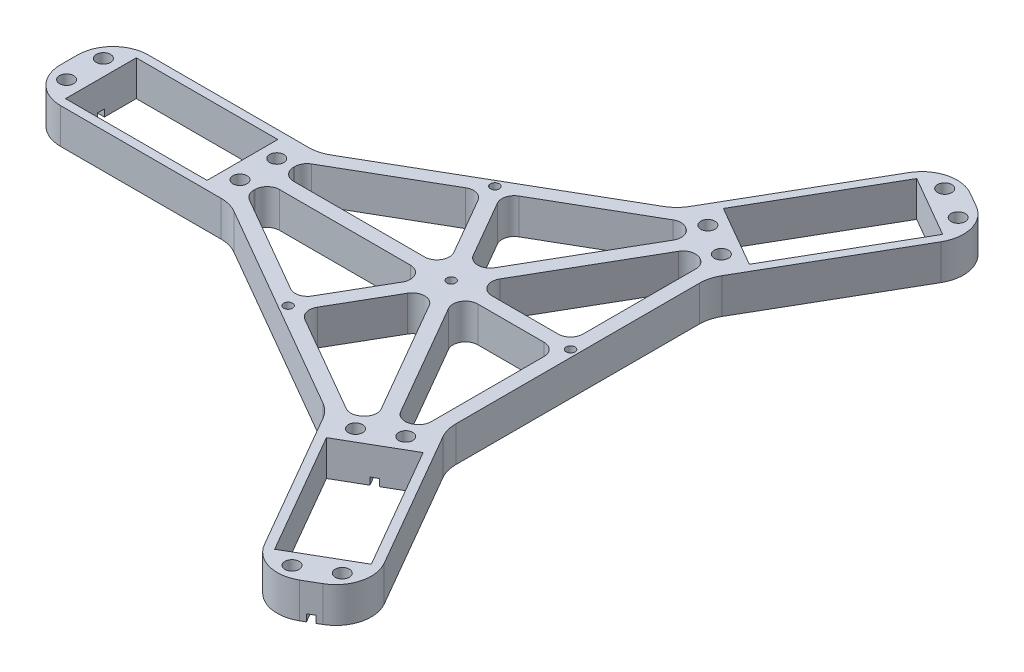
from build123d import *

# Parameters (mm, degrees)
SKETCH1_R           = 2
SKETCH1_W           = 40
SKETCH1_H           = 20
SKETCH1_R_2         = 1.25
BOSS_EXTRUDE1_DEPTH = 10
SKETCH2_W           = 2
SKETCH2_H           = 4
CUT_EXTRUDE1_DEPTH  = 56
SKETCH3_W           = 2
SKETCH3_H           = 4
CUT_EXTRUDE2_DEPTH  = 56
SKETCH4_W           = 2
SKETCH4_H           = 4
CUT_EXTRUDE3_DEPTH  = 56
FILLET1_R           = 10
FILLET2_R           = 3.5


with BuildPart() as part:
    # Sketch1 → Boss-Extrude1 (new body)
    with BuildSketch(Plane(origin=(0, 0, 0), x_dir=(1, 0, 0), z_dir=(0, 1, 0))):
        Polygon((-9, 22.4), (-9, -2.4), (49, -2.4), (113.261284993, -39.501270189), (142.261284993, -89.730743609), (163.738715007, -77.330743609), (134.738715007, -27.101270189), (134.738715007, 47.101270189), (163.738715007, 97.330743609), (142.261284993, 109.730743609), (113.261284993, 59.501270189), (49, 22.4), align=None)
        Polygon((49, 12), (49, 17.781197846), (81.398591689, 36.486533479), (95.535898385, 12), align=None, mode=Mode.SUBTRACT)
        Polygon((49, 2.218802154), (49, 8), (95.535898385, 8), (81.398591689, -16.486533479), align=None, mode=Mode.SUBTRACT)
        with Locations((-4.5, 4.8)):
            Circle(SKETCH1_R, mode=Mode.SUBTRACT)
        with Locations((44.5, 4.8)):
            Circle(SKETCH1_R, mode=Mode.SUBTRACT)
        with Locations((-4.5, 15.2)):
            Circle(SKETCH1_R, mode=Mode.SUBTRACT)
        with Locations((20, 10)):
            Rectangle(SKETCH1_W, SKETCH1_H, mode=Mode.SUBTRACT)
        with Locations((44.5, 15.2)):
            Circle(SKETCH1_R, mode=Mode.SUBTRACT)
        Polygon((84.862693304, 38.486533479), (117.261284993, 57.191869112), (122.267949192, 54.301270189), (99, 14), align=None, mode=Mode.SUBTRACT)
        with Locations((82.130642497, 39.218584287)):
            Circle(SKETCH1_R_2, mode=Mode.SUBTRACT)
        with Locations((82.130642497, -19.218584287)):
            Circle(SKETCH1_R_2, mode=Mode.SUBTRACT)
        Polygon((117.261284993, -37.191869112), (84.862693304, -18.486533479), (99, 6), (122.267949192, -34.301270189), align=None, mode=Mode.SUBTRACT)
        Polygon((125.732050808, 52.301270189), (130.738715007, 49.410671266), (130.738715007, 12), (102.464101615, 12), align=None, mode=Mode.SUBTRACT)
        with Locations((121.7466679, 59.798384506)):
            Circle(SKETCH1_R, mode=Mode.SUBTRACT)
        with Locations((130.7533321, 54.598384506)):
            Circle(SKETCH1_R, mode=Mode.SUBTRACT)
        Polygon((119.839745962, 66.095498823), (139.839745962, 100.736514975), (157.160254038, 90.736514975), (137.160254038, 56.095498823), align=None, mode=Mode.SUBTRACT)
        with Locations((155.2533321, 97.033629292)):
            Circle(SKETCH1_R, mode=Mode.SUBTRACT)
        with Locations((146.2466679, 102.233629292)):
            Circle(SKETCH1_R, mode=Mode.SUBTRACT)
        Polygon((130.738715007, -29.410671266), (125.732050808, -32.301270189), (102.464101615, 8), (130.738715007, 8), align=None, mode=Mode.SUBTRACT)
        with Locations((146.2466679, -82.233629292)):
            Circle(SKETCH1_R, mode=Mode.SUBTRACT)
        with Locations((155.2533321, -77.033629292)):
            Circle(SKETCH1_R, mode=Mode.SUBTRACT)
        Polygon((137.160254038, -36.095498823), (157.160254038, -70.736514975), (139.839745962, -80.736514975), (119.839745962, -46.095498823), align=None, mode=Mode.SUBTRACT)
        with Locations((121.7466679, -39.798384506)):
            Circle(SKETCH1_R, mode=Mode.SUBTRACT)
        with Locations((130.7533321, -34.598384506)):
            Circle(SKETCH1_R, mode=Mode.SUBTRACT)
        with Locations((132.738715007, 10)):
            Circle(SKETCH1_R_2, mode=Mode.SUBTRACT)
        with Locations((99, 10)):
            Circle(SKETCH1_R_2, mode=Mode.SUBTRACT)
    extrude(amount=BOSS_EXTRUDE1_DEPTH)

    # Sketch2 → Cut-Extrude1 (cut)
    with BuildSketch(Plane.ZY.offset(9)):
        with Locations((-10, 0)):
            Rectangle(SKETCH2_W, SKETCH2_H)
    extrude(amount=-CUT_EXTRUDE1_DEPTH, mode=Mode.SUBTRACT)

    # Sketch3 → Cut-Extrude2 (cut)
    with BuildSketch(Plane(origin=(74.419872981, 0, 128.899001096), x_dir=(0.8660254037844434, 0, -0.49999999999999173), z_dir=(0.49999999999999173, 0, 0.8660254037844434))):
        with Locations((90.736514975, 0)):
            Rectangle(SKETCH3_W, SKETCH3_H)
    extrude(amount=-CUT_EXTRUDE2_DEPTH, mode=Mode.SUBTRACT)

    # Sketch4 → Cut-Extrude3 (cut)
    with BuildSketch(Plane(origin=(83.080127019, 0, -143.899001096), x_dir=(-0.8660254037844363, 0, -0.5000000000000043), z_dir=(0.5000000000000043, 0, -0.8660254037844363))):
        with Locations((-80.736514975, 0)):
            Rectangle(SKETCH4_W, SKETCH4_H)
    extrude(amount=-CUT_EXTRUDE3_DEPTH, mode=Mode.SUBTRACT)

    # Fillet1
    fillet1_edges = [part.edges().sort_by_distance(p)[0] for p in [
        (113.261284993, 5, 39.501270189),
        (134.738715007, 5, 27.101270189),
        (134.738715007, 5, -47.101270189),
        (113.261284993, 5, -59.501270189),
        (49, 5, -22.4),
        (49, 5, 2.4),
        (142.261284993, 5, -109.730743609),
        (163.738715007, 5, -97.330743609),
        (163.738715007, 5, 77.330743609),
        (142.261284993, 5, 89.730743609),
        (-9, 5, -22.4),
        (-9, 5, 2.4),
    ]]
    fillet(fillet1_edges, radius=FILLET1_R)

    # Fillet2
    fillet2_edges = [part.edges().sort_by_distance(p)[0] for p in [
        (84.862693304, 5, -38.486533479),
        (122.267949192, 5, -54.301270189),
        (117.261284993, 5, -57.191869112),
        (125.732050808, 5, -52.301270189),
        (130.738715007, 5, -49.410671266),
        (130.738715007, 5, -12),
        (130.738715007, 5, -8),
        (130.738715007, 5, 29.410671266),
        (125.732050808, 5, 32.301270189),
        (122.267949192, 5, 34.301270189),
        (117.261284993, 5, 37.191869112),
        (84.862693304, 5, 18.486533479),
        (81.398591689, 5, 16.486533479),
        (49, 5, -8),
        (49, 5, -2.218802154),
        (49, 5, -12),
        (49, 5, -17.781197846),
        (95.535898385, 5, -8),
        (99, 5, -6),
        (102.464101615, 5, -8),
        (102.464101615, 5, -12),
        (99, 5, -14),
        (95.535898385, 5, -12),
        (81.398591689, 5, -36.486533479),
    ]]
    fillet(fillet2_edges, radius=FILLET2_R)


solid = part.part
